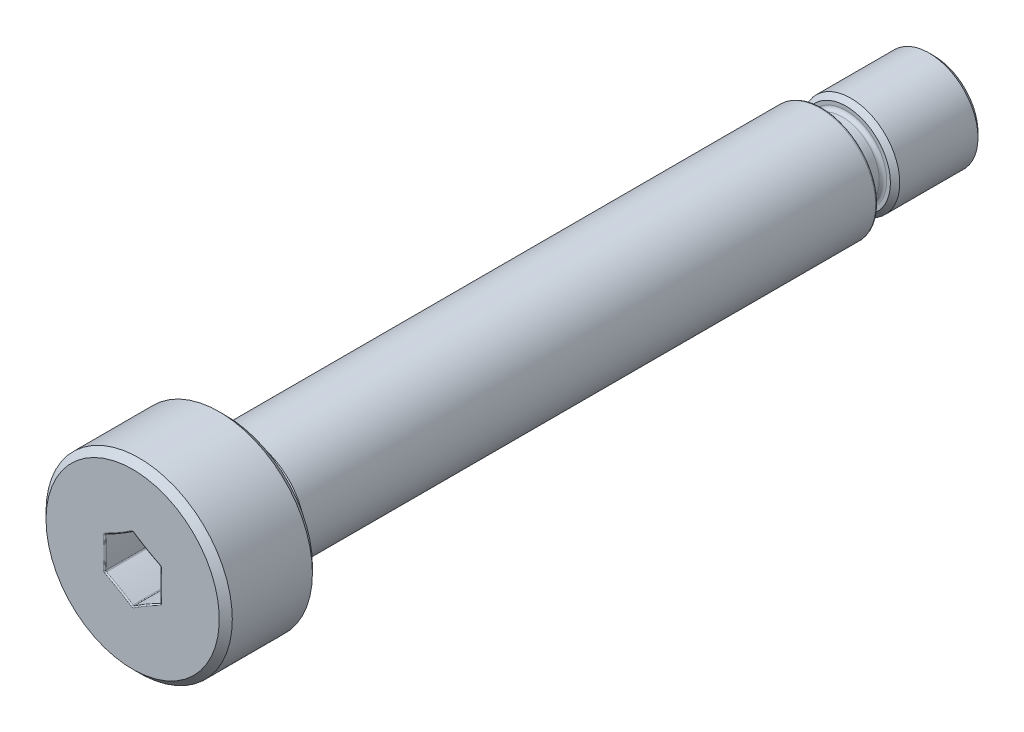
from build123d import *

# Parameters (mm, degrees)
SKETCH4_W          = 0.9921875
SKETCH4_H          = 0.3571875
SKETCH4_W_2        = 1.031875
SKETCH4_H_2        = 0.515555748
CHAMFER1_SIZE      = 0.3571875
FILLET1_R          = 0.17859375
FILLET2_R          = 0.15875
CHAMFER2_SIZE      = 0.1984375
FILLET3_R          = 0.09525
CHAMFER3_SIZE      = 0.2778125
CUT_EXTRUDE1_DEPTH = 2.0828
FILLET4_R          = 0.0508


with BuildPart() as part:
    # Sketch3 → Revolve1 (revolve)
    with BuildSketch(Plane(origin=(0, 0, 0), x_dir=(0, 0, -1), z_dir=(1, 0, 0)), mode=Mode.PRIVATE) as revolve1_sk:
        Polygon((-3.96875, 3.96875), (0, 3.96875), (0, 2.38125), (25.4, 2.38125), (25.4, 2.0828), (30.1625, 2.0828), (30.1625, 0), (-3.96875, 0), align=None)
    revolve(revolve1_sk.sketch.rotate(Axis((0, 0, 3.96875), (0, 0, -1)), 90), axis=Axis((0, 0, 3.96875), (0, 0, -1)))

    # Sketch4 → Cut-Revolve1 (revolve, cut)
    with BuildSketch(Plane(origin=(0, 0, 0), x_dir=(0, 0, -1), z_dir=(1, 0, 0)), mode=Mode.PRIVATE) as cut_revolve1_sk:
        with Locations((0.49609375, 2.20265625)):
            Rectangle(SKETCH4_W, SKETCH4_H)
        with Locations((25.9159375, 1.825022126)):
            Rectangle(SKETCH4_W_2, SKETCH4_H_2)
    revolve(cut_revolve1_sk.sketch.rotate(Axis((0, 0, 3.96875), (0, 0, -1)), 90), axis=Axis((0, 0, 3.96875), (0, 0, -1)), mode=Mode.SUBTRACT)

    # Chamfer1
    chamfer1_edges = [part.edges().sort_by_distance(p)[0] for p in [
        (-2.0240625, 0, -0.9921875),
    ]]
    chamfer(chamfer1_edges, length=CHAMFER1_SIZE - 0.0001)  # a hair under: the kernel refuses the full size

    # Fillet1
    fillet1_edges = [part.edges().sort_by_distance(p)[0] for p in [
        (-2.0240625, 0, 0),
    ]]
    fillet(fillet1_edges, radius=FILLET1_R)

    # Fillet2
    fillet2_edges = [part.edges().sort_by_distance(p)[0] for p in [
        (-1.567244252, 0, -25.4),
        (-1.567244252, 0, -26.431875),
    ]]
    fillet(fillet2_edges, radius=FILLET2_R)

    # Chamfer2
    chamfer2_edges = [part.edges().sort_by_distance(p)[0] for p in [
        (-2.0828, 0, -26.431875),
        (-2.0828, 0, -30.1625),
    ]]
    chamfer(chamfer2_edges, length=CHAMFER2_SIZE)

    # Fillet3
    fillet3_edges = [part.edges().sort_by_distance(p)[0] for p in [
        (-2.38125, 0, -25.4),
    ]]
    fillet(fillet3_edges, radius=FILLET3_R)

    # Chamfer3
    chamfer3_edges = [part.edges().sort_by_distance(p)[0] for p in [
        (-3.96875, 0, 0),
        (-3.96875, 0, 3.96875),
    ]]
    chamfer(chamfer3_edges, length=CHAMFER3_SIZE)

    # Sketch5 → Cut-Extrude1 (cut)
    with BuildSketch(Plane.XY.offset(3.96875)):
        with BuildLine():
            ThreePointArc((1.190625, 0.687407664), (0.58340625, 1.010489266), (0, 1.374815329))
            ThreePointArc((0, 1.374815329), (-0.58340625, 1.010489266), (-1.190625, 0.687407664))
            ThreePointArc((-1.190625, 0.687407664), (-1.1668125, 0), (-1.190625, -0.687407664))
            ThreePointArc((-1.190625, -0.687407664), (-0.58340625, -1.010489266), (0, -1.374815329))
            ThreePointArc((0, -1.374815329), (0.58340625, -1.010489266), (1.190625, -0.687407664))
            ThreePointArc((1.190625, -0.687407664), (1.1668125, 0), (1.190625, 0.687407664))
        make_face()
    extrude(amount=-CUT_EXTRUDE1_DEPTH, mode=Mode.SUBTRACT)

    # Fillet4
    fillet4_edges = [part.edges().sort_by_distance(p)[0] for p in [
        (1.1668125, 0, 1.88595),
        (1.190625, 0.687407664, 2.92735),
        (0.58340625, -1.010489266, 1.88595),
        (1.190625, -0.687407664, 2.92735),
        (-0.58340625, -1.010489266, 1.88595),
        (0, -1.374815329, 2.92735),
        (-1.1668125, 0, 1.88595),
        (-1.190625, -0.687407664, 2.92735),
        (-0.58340625, 1.010489266, 1.88595),
        (-1.190625, 0.687407664, 2.92735),
        (0.58340625, 1.010489266, 1.88595),
        (0, 1.374815329, 2.92735),
        (1.1668125, 0, 3.96875),
        (0.58340625, 1.010489266, 3.96875),
        (-0.58340625, 1.010489266, 3.96875),
        (-1.1668125, 0, 3.96875),
        (-0.58340625, -1.010489266, 3.96875),
        (0.58340625, -1.010489266, 3.96875),
    ]]
    fillet(fillet4_edges, radius=FILLET4_R)


solid = part.part
